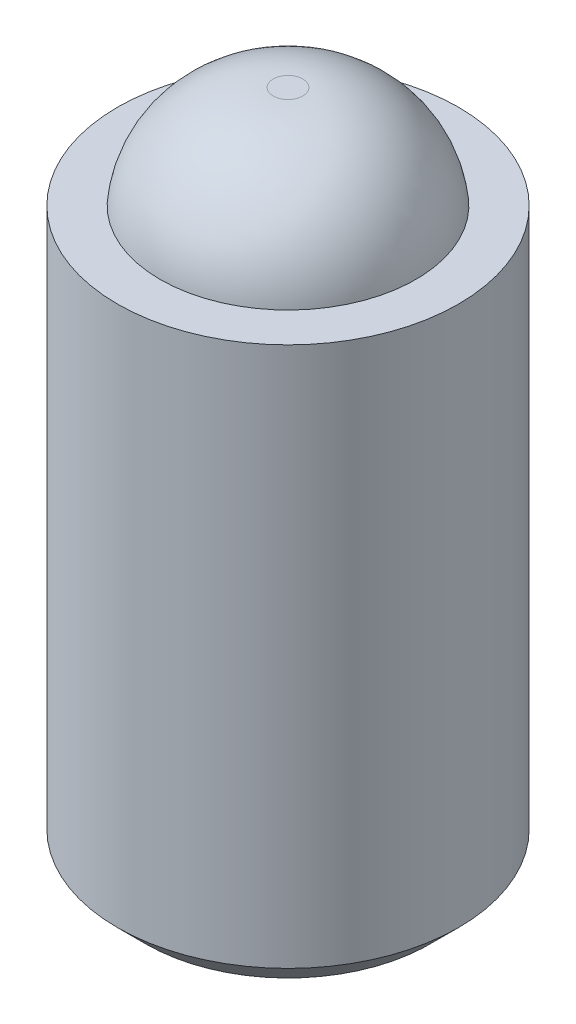
from build123d import *

# Parameters (mm, degrees)
SKETCH_1_R          = 3
EXTRUDE_1_DEPTH     = 10
SKETCH_2_R          = 2.25
EXTRUDE_2_DEPTH     = 1.8
FILLET_2_R          = 2
CHAMFER_1_SIZE      = 0.5
CUT_EXTRUDE_1_DEPTH = 1.8


with BuildPart() as part:
    # 草图1 → 凸台-拉伸1 (new body)
    with BuildSketch(Plane(origin=(0, 0, 0), x_dir=(1, 0, 0), z_dir=(0, 1, 0))):
        with Locations(Location((0, 0, 0), (0, 0, 270))):
            Circle(SKETCH_1_R)
    extrude(amount=EXTRUDE_1_DEPTH)

    # 草图2 → 凸台-拉伸2 (add)
    with BuildSketch(Plane(origin=(0, 10, 0), x_dir=(1, 0, 0), z_dir=(0, 1, 0))):
        with Locations(Location((0, 0, 0), (0, 0, 270))):
            Circle(SKETCH_2_R)
    extrude(amount=EXTRUDE_2_DEPTH)

    # 圆角2
    # the kernel refuses this fillet: 2 mm, written as the material it takes off along each edge
    with BuildSketch(Plane(origin=(0, 11.8, 0), x_dir=(0, 0, 1), z_dir=(-1, 0, 0))) as fillet_2_piece_1:
        with BuildLine():
            CenterArc((0.260025126, -2), FILLET_2_R, 5.739170477, 84.260829523)
            Line((0.260025126, 0), (0.260025126, 0.04))
            Line((0.260025126, 0.04), (2.25, 0.04))
            Line((2.25, 0.04), (2.29, 0))
            ThreePointArc((2.29, 0), (2.29, -0.9), (2.289799497, -1.796))
            Line((2.289799497, -1.796), (2.25, -1.8))
        make_face()
    revolve(axis=Axis((0, 11.8, 0), (0, 1, 0)), mode=Mode.SUBTRACT)

    # 倒角1
    chamfer_1_edges = [part.edges().sort_by_distance(p)[0] for p in [
        (0, 0, -3),
    ]]
    chamfer(chamfer_1_edges, length=CHAMFER_1_SIZE)

    # 草图3 → 切除-拉伸1 (cut)
    with BuildSketch(Plane.XZ):
        Polygon((0, 1.808769012), (-1.566439914, 0.904384506), (-1.566439914, -0.904384506), (0, -1.808769012), (1.566439914, -0.904384506), (1.566439914, 0.904384506), align=None)
    extrude(amount=-CUT_EXTRUDE_1_DEPTH, mode=Mode.SUBTRACT)


solid = part.part
